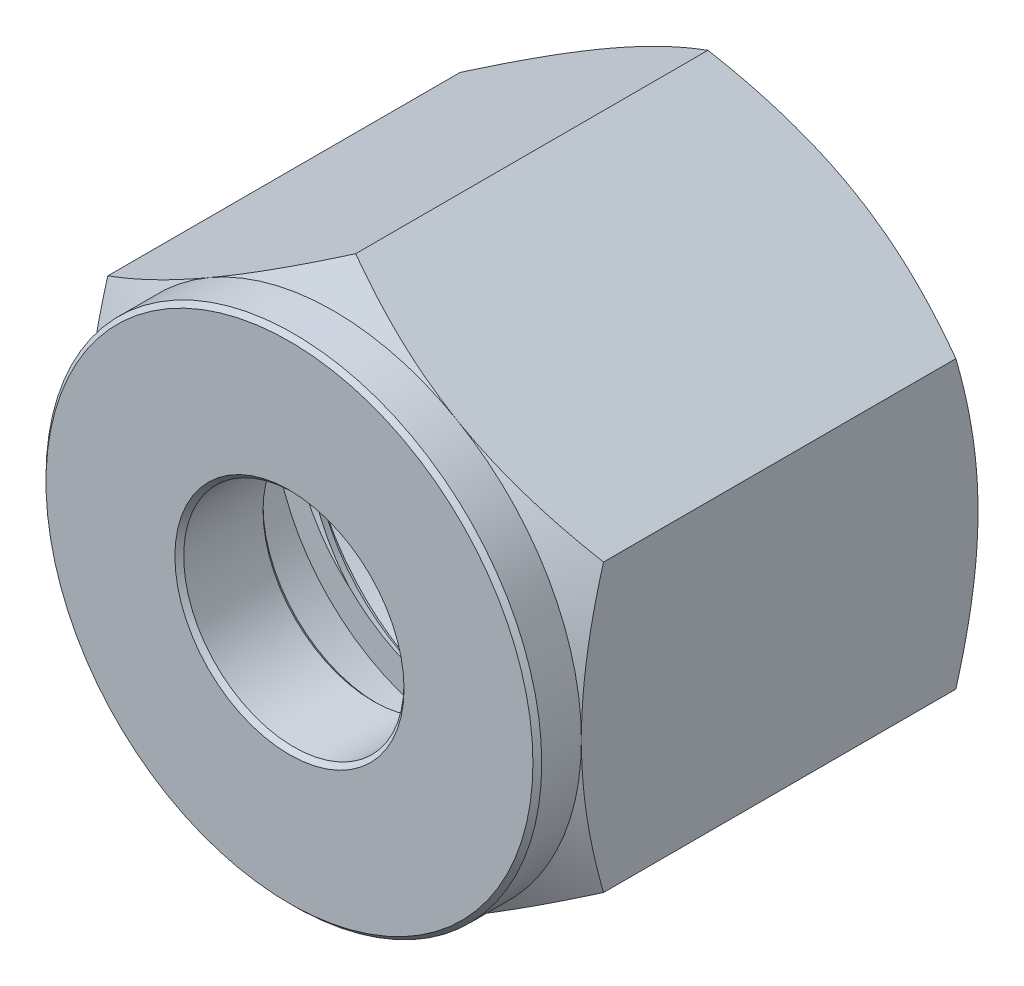
from build123d import *

# Parameters (mm, degrees)
BOSS_EXTRUDE1_DEPTH          = 12.7
SWEEP1_PITCH                 = 1.27
SKETCH6_R                    = 5.693731533
CUT_EXTRUDE1_OTHER_WAY_DEPTH = 17.744174636
CUT_EXTRUDE1_OTHER_WAY_TAPER = -45
CHAMFER1_SIZE                = 0.127
SKETCH7_W                    = 2.54
SKETCH7_H                    = 1.27


with BuildPart() as part:
    # Sketch2 → Boss-Extrude1 (new body)
    with BuildSketch(Plane.XY):
        Polygon((0, 8.248891971), (-7.14375, 4.124445986), (-7.14375, -4.124445986), (0, -8.248891971), (7.14375, -4.124445986), (7.14375, 4.124445986), align=None)
    extrude(amount=-BOSS_EXTRUDE1_DEPTH)

    # Sketch3 → Cut-Revolve1 (revolve, cut)
    with BuildSketch(Plane(origin=(0, 0, 0), x_dir=(0, 0, -1), z_dir=(1, 0, 0)), mode=Mode.PRIVATE) as cut_revolve1_sk:
        Polygon((0, 8.248891971), (0, 7.14375), (1.27, 7.14375), (1.908054014, 8.248891971), (12.061945986, 8.248891971), (12.7, 7.14375), (12.7, 8.248891971), (12.7, 9.354033942), (0, 9.354033942), align=None)
        Polygon((0, 3.175), (0, 0), (12.7, 0), (12.7, 5.55625), (5.08, 5.55625), (5.08, 4.92125), (2.54, 4.92125), (2.54, 4.28625), (2.54, 3.175), align=None)
    revolve(cut_revolve1_sk.sketch.rotate(Axis((0, 0, 0), (0, 0, -1)), 90), axis=Axis((0, 0, 0), (0, 0, -1)), mode=Mode.SUBTRACT)

    # Sweep1: the profile of Sketch5 screwed along a right-hand helix of 7 turns, 8 arcs to a turn; built about Z, then put on its axis
    sweep1_z = Axis((0, 0, 0), (0, 0, 1))
    sweep1_corners = [(4.731360803, 0, -0.47625), (5.624990766, 0, 0.0396875), (5.624990766, 0, -1.1509375), (4.731360803, 0, -0.635)]
    with BuildLine(mode=Mode.PRIVATE) as sweep1_profile:
        Line(sweep1_corners[0], sweep1_corners[1])
        Line(sweep1_corners[1], sweep1_corners[2])
        Line(sweep1_corners[2], sweep1_corners[3])
        Line(sweep1_corners[3], sweep1_corners[0])
    sweep1_cap = Face(sweep1_profile.wire())
    sweep1_turn_angles = [0, 22.5, 45, 67.5, 90, 112.5, 135, 157.5, 180, 202.5, 225, 247.5, 270, 292.5, 315, 337.5, 360]
    sweep1_turn_weights = [1, 0.9238795325112867, 1, 0.9238795325112867, 1, 0.9238795325112867, 1, 0.9238795325112867, 1, 0.9238795325112867, 1, 0.9238795325112867, 1, 0.9238795325112867, 1, 0.9238795325112867, 1]
    sweep1_turn_rails = [Edge.make_bspline([Vector(p[0], p[1], 0).rotate(sweep1_z, sweep1_turn_angles[k]) / sweep1_turn_weights[k] + Vector(0, 0, p[2] + SWEEP1_PITCH * sweep1_turn_angles[k] / 360) for k in range(17)], [0, 0, 0, 1, 1, 2, 2, 3, 3, 4, 4, 5, 5, 6, 6, 7, 7, 8, 8, 8], 2, sweep1_turn_weights) for p in sweep1_corners]
    sweep1_turn_sides = [Face.make_surface_from_curves(sweep1_turn_rails[p[0]], sweep1_turn_rails[p[1]]) for p in [(0, 1), (1, 2), (2, 3), (3, 0)]]
    sweep1 = Plane(origin=(0, 0, -12.7), x_dir=(0, 1, 0), z_dir=(0, 0, 1)) * Solid(Shell([*[p.moved(Location((0, 0, SWEEP1_PITCH * i))) for i in range(7) for p in sweep1_turn_sides], sweep1_cap, sweep1_cap.rotate(sweep1_z, 2520).moved(Location((0, 0, SWEEP1_PITCH * 2520 / 360)))]))
    add(sweep1)

    # Cut-Extrude1 cone 1 section (through the dimple's axis) → Cut-Extrude1 (revolve, cut)
    with BuildSketch(Plane(origin=(0, 0, -12.7), x_dir=(0, 1, 0), z_dir=(1, 0, 0))):
        Polygon((0, 0), (5.693731533, 0), (0, 5.693731533), align=None)
    revolve(axis=Axis((0, 0, -12.7), (0, 0, 1)), mode=Mode.SUBTRACT)

    # Sketch6 → Cut-Extrude1 other way (cut)
    with BuildSketch(Plane(origin=(0, 0, -12.7), x_dir=(-1, 0, 0), z_dir=(0, 0, -1))):
        Circle(SKETCH6_R)
    extrude(amount=CUT_EXTRUDE1_OTHER_WAY_DEPTH, taper=CUT_EXTRUDE1_OTHER_WAY_TAPER, mode=Mode.SUBTRACT)

    # Chamfer1
    chamfer1_edges = [part.edges().sort_by_distance(p)[0] for p in [
        (-7.14375, 0, 0),
        (-3.175, 0, -2.54),
        (-3.175, 0, 0),
    ]]
    chamfer(chamfer1_edges, length=CHAMFER1_SIZE)

    # Sketch7 → Cut-Revolve2 (revolve, cut)
    with BuildSketch(Plane(origin=(0, 0, 0), x_dir=(0, 0, -1), z_dir=(1, 0, 0)), mode=Mode.PRIVATE) as cut_revolve2_sk:
        with Locations((3.81, 4.92125)):
            Rectangle(SKETCH7_W, SKETCH7_H)
    revolve(cut_revolve2_sk.sketch.rotate(Axis((0, 0, 0), (0, 0, -1)), 90), axis=Axis((0, 0, 0), (0, 0, -1)), mode=Mode.SUBTRACT)


solid = part.part
